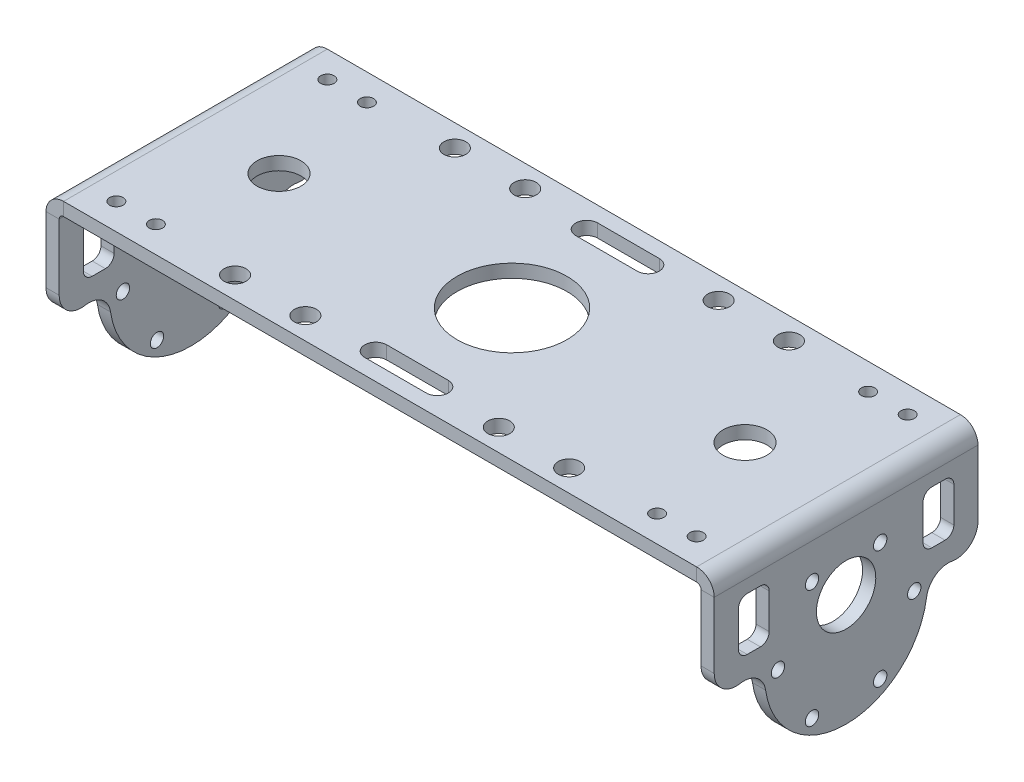
from build123d import *

# Parameters (mm, degrees)
SKETCH_1_W             = 144
SKETCH_1_H             = 60
SM_BASE_FLANGE_1_DEPTH = 3
SM_EDGE_FLANGE_1_DEPTH = 60
SM_EDGE_FLANGE_2_DEPTH = 60
CUT_EXTRUDE_1_REACH    = 162.265
SKETCH_16_R            = 1.525
SKETCH_16_R_2          = 6.75
CUT_EXTRUDE_2_REACH    = 94.801
SKETCH_19_W            = 14
SKETCH_19_H            = 5
CUT_EXTRUDE_3_REACH    = 94.801
SKETCH_22_R            = 1.525
CUT_EXTRUDE_4_REACH    = 94.801
SKETCH_25_R            = 2.5
CUT_EXTRUDE_5_REACH    = 94.801
SKETCH_28_R            = 12.5
SKETCH_28_R_2          = 5
SKETCH_29_W            = 7
SKETCH_29_H            = 12
CUT_EXTRUDE_6_DEPTH    = 161.265404876
FILLET_1_R             = 2
FILLET_2_R             = 2


# Sheet-metal steps are written as plain solids
with BuildPart() as part:
    # Sketch 1 → 基体-法兰1 (new body)
    with BuildSketch(Plane(origin=(0, 0, 0), x_dir=(1, 0, 0), z_dir=(0, 1, 0))):
        Rectangle(SKETCH_1_W, SKETCH_1_H)
    extrude(amount=SM_BASE_FLANGE_1_DEPTH)

    # 边线-法兰1 section (across the edge) → 边线-法兰1 (add)
    with BuildSketch(Plane(origin=(73, 0, -30), x_dir=(-1, 0, 0), z_dir=(0, 0, 1))):
        with BuildLine():
            Line((-3, 1), (-3, 41))
            Line((-3, 41), (0, 41))
            Line((0, 41), (0, 1))
            ThreePointArc((0, 1), (0.292893219, 0.292893219), (1, 0))
            Line((1, 0), (1, -3))
            ThreePointArc((1, -3), (-1.828427125, -1.828427125), (-3, 1))
        make_face()
    extrude(amount=SM_EDGE_FLANGE_1_DEPTH)

    # 边线-法兰2 section (across the edge) → 边线-法兰2 (add)
    with BuildSketch(Plane(origin=(-73, 0, 30), x_dir=(1, 0, 0), z_dir=(0, 0, -1))):
        with BuildLine():
            Line((-3, 1), (-3, 41))
            Line((-3, 41), (0, 41))
            Line((0, 41), (0, 1))
            ThreePointArc((0, 1), (0.292893219, 0.292893219), (1, 0))
            Line((1, 0), (1, -3))
            ThreePointArc((1, -3), (-1.828427125, -1.828427125), (-3, 1))
        make_face()
    extrude(amount=SM_EDGE_FLANGE_2_DEPTH)

    # 切除-拉伸1: up to this face of the body (flat: up to its plane)
    cut_extrude_1_end = Plane(part.part.faces().sort_by_distance((76, -21, 0))[0])
    # 草图16 → 切除-拉伸1 (cut, up to the picked face)
    with BuildSketch(Plane.ZY.offset(76), mode=Mode.PRIVATE) as cut_extrude_1_sk1:
        with Locations(Location((15.5, -22.5, 0), (0, 0, 90))):
            Circle(SKETCH_16_R)
    cut_extrude_1_tool1 = split(extrude(cut_extrude_1_sk1.sketch, amount=-CUT_EXTRUDE_1_REACH, mode=Mode.PRIVATE), bisect_by=cut_extrude_1_end, keep=Keep.BOTH, mode=Mode.PRIVATE)
    # 草图16 → 切除-拉伸1 (cut, up to the picked face)
    with BuildSketch(Plane.ZY.offset(76), mode=Mode.PRIVATE) as cut_extrude_1_sk2:
        with Locations(Location((7.75, -35.923393759, 0), (0, 0, 90))):
            Circle(SKETCH_16_R)
    cut_extrude_1_tool2 = split(extrude(cut_extrude_1_sk2.sketch, amount=-CUT_EXTRUDE_1_REACH, mode=Mode.PRIVATE), bisect_by=cut_extrude_1_end, keep=Keep.BOTH, mode=Mode.PRIVATE)
    # 草图16 → 切除-拉伸1 (cut, up to the picked face)
    with BuildSketch(Plane.ZY.offset(76), mode=Mode.PRIVATE) as cut_extrude_1_sk3:
        with BuildLine():
            ThreePointArc((24.130177502, -20.923759623), (20.328772761, -21.797108704), (18.311343301, -25.135281108))
            ThreePointArc((18.311343301, -25.135281108), (12.113985709, -36.482179739), (0, -41))
            Line((0, -41), (30, -41))
            Line((30, -41), (30, -16))
            ThreePointArc((30, -16), (28.213322853, -19.830738342), (24.130177502, -20.923759623))
        make_face()
    cut_extrude_1_tool3 = split(extrude(cut_extrude_1_sk3.sketch, amount=-CUT_EXTRUDE_1_REACH, mode=Mode.PRIVATE), bisect_by=cut_extrude_1_end, keep=Keep.BOTH, mode=Mode.PRIVATE)
    # 草图16 → 切除-拉伸1 (cut, up to the picked face)
    with BuildSketch(Plane.ZY.offset(76), mode=Mode.PRIVATE) as cut_extrude_1_sk4:
        with Locations(Location((-15.5, -22.5, 0), (0, 0, 90))):
            Circle(SKETCH_16_R)
    cut_extrude_1_tool4 = split(extrude(cut_extrude_1_sk4.sketch, amount=-CUT_EXTRUDE_1_REACH, mode=Mode.PRIVATE), bisect_by=cut_extrude_1_end, keep=Keep.BOTH, mode=Mode.PRIVATE)
    # 草图16 → 切除-拉伸1 (cut, up to the picked face)
    with BuildSketch(Plane.ZY.offset(76), mode=Mode.PRIVATE) as cut_extrude_1_sk5:
        with Locations(Location((0, -15.5, 0), (0, 0, 90))):
            Circle(SKETCH_16_R_2)
    cut_extrude_1_tool5 = split(extrude(cut_extrude_1_sk5.sketch, amount=-CUT_EXTRUDE_1_REACH, mode=Mode.PRIVATE), bisect_by=cut_extrude_1_end, keep=Keep.BOTH, mode=Mode.PRIVATE)
    # 草图16 → 切除-拉伸1 (cut, up to the picked face)
    with BuildSketch(Plane.ZY.offset(76), mode=Mode.PRIVATE) as cut_extrude_1_sk6:
        with Locations(Location((7.75, -9.076606241, 0), (0, 0, 90))):
            Circle(SKETCH_16_R)
    cut_extrude_1_tool6 = split(extrude(cut_extrude_1_sk6.sketch, amount=-CUT_EXTRUDE_1_REACH, mode=Mode.PRIVATE), bisect_by=cut_extrude_1_end, keep=Keep.BOTH, mode=Mode.PRIVATE)
    # 草图16 → 切除-拉伸1 (cut, up to the picked face)
    with BuildSketch(Plane.ZY.offset(76), mode=Mode.PRIVATE) as cut_extrude_1_sk7:
        with BuildLine():
            Line((-30, -41), (0, -41))
            ThreePointArc((0, -41), (-12.113985709, -36.482179739), (-18.311343301, -25.135281108))
            ThreePointArc((-18.311343301, -25.135281108), (-20.328772761, -21.797108704), (-24.130177502, -20.923759623))
            ThreePointArc((-24.130177502, -20.923759623), (-28.213322853, -19.830738342), (-30, -16))
            Line((-30, -16), (-30, -41))
        make_face()
    cut_extrude_1_tool7 = split(extrude(cut_extrude_1_sk7.sketch, amount=-CUT_EXTRUDE_1_REACH, mode=Mode.PRIVATE), bisect_by=cut_extrude_1_end, keep=Keep.BOTH, mode=Mode.PRIVATE)
    # 草图16 → 切除-拉伸1 (cut, up to the picked face)
    with BuildSketch(Plane.ZY.offset(76), mode=Mode.PRIVATE) as cut_extrude_1_sk8:
        with Locations(Location((-7.75, -35.923393759, 0), (0, 0, 90))):
            Circle(SKETCH_16_R)
    cut_extrude_1_tool8 = split(extrude(cut_extrude_1_sk8.sketch, amount=-CUT_EXTRUDE_1_REACH, mode=Mode.PRIVATE), bisect_by=cut_extrude_1_end, keep=Keep.BOTH, mode=Mode.PRIVATE)
    # 草图16 → 切除-拉伸1 (cut, up to the picked face)
    with BuildSketch(Plane.ZY.offset(76), mode=Mode.PRIVATE) as cut_extrude_1_sk9:
        with Locations(Location((-7.75, -9.076606241, 0), (0, 0, 90))):
            Circle(SKETCH_16_R)
    cut_extrude_1_tool9 = split(extrude(cut_extrude_1_sk9.sketch, amount=-CUT_EXTRUDE_1_REACH, mode=Mode.PRIVATE), bisect_by=cut_extrude_1_end, keep=Keep.BOTH, mode=Mode.PRIVATE)
    add(cut_extrude_1_tool1.solids().sort_by(Axis((-76, -22.5, 15.5), (1, 0, 0)))[0], mode=Mode.SUBTRACT)
    add(cut_extrude_1_tool2.solids().sort_by(Axis((-76, -35.923394, 7.75), (1, 0, 0)))[0], mode=Mode.SUBTRACT)
    add(cut_extrude_1_tool3.solids().sort_by(Axis((-76, -32.323593, 22.013669), (1, 0, 0)))[0], mode=Mode.SUBTRACT)
    add(cut_extrude_1_tool4.solids().sort_by(Axis((-76, -22.5, -15.5), (1, 0, 0)))[0], mode=Mode.SUBTRACT)
    add(cut_extrude_1_tool5.solids().sort_by(Axis((-76, -15.5, 0), (1, 0, 0)))[0], mode=Mode.SUBTRACT)
    add(cut_extrude_1_tool6.solids().sort_by(Axis((-76, -9.076606, 7.75), (1, 0, 0)))[0], mode=Mode.SUBTRACT)
    add(cut_extrude_1_tool7.solids().sort_by(Axis((-76, -32.323593, -22.013669), (1, 0, 0)))[0], mode=Mode.SUBTRACT)
    add(cut_extrude_1_tool8.solids().sort_by(Axis((-76, -35.923394, -7.75), (1, 0, 0)))[0], mode=Mode.SUBTRACT)
    add(cut_extrude_1_tool9.solids().sort_by(Axis((-76, -9.076606, -7.75), (1, 0, 0)))[0], mode=Mode.SUBTRACT)

    # 草图19 → 切除-拉伸2 (cut, up to next)
    with BuildSketch(Plane(origin=(0, 3, 0), x_dir=(1, 0, 0), z_dir=(0, 1, 0)), mode=Mode.PRIVATE) as cut_extrude_2_sk1:
        with BuildLine():
            ThreePointArc((-7, -26.5), (-9.5, -24), (-7, -21.5))
            Line((-7, -21.5), (-7, -26.5))
        make_face()
    cut_extrude_2_tool1 = extrude(cut_extrude_2_sk1.sketch, amount=-CUT_EXTRUDE_2_REACH, mode=Mode.PRIVATE) & part.part
    # 草图19 → 切除-拉伸2 (cut, up to next)
    with BuildSketch(Plane(origin=(0, 3, 0), x_dir=(1, 0, 0), z_dir=(0, 1, 0)), mode=Mode.PRIVATE) as cut_extrude_2_sk2:
        with Locations((0, -24)):
            Rectangle(SKETCH_19_W, SKETCH_19_H)
    cut_extrude_2_tool2 = extrude(cut_extrude_2_sk2.sketch, amount=-CUT_EXTRUDE_2_REACH, mode=Mode.PRIVATE) & part.part
    # 草图19 → 切除-拉伸2 (cut, up to next)
    with BuildSketch(Plane(origin=(0, 3, 0), x_dir=(1, 0, 0), z_dir=(0, 1, 0)), mode=Mode.PRIVATE) as cut_extrude_2_sk3:
        with BuildLine():
            ThreePointArc((7, -21.5), (9.5, -24), (7, -26.5))
            Line((7, -26.5), (7, -21.5))
        make_face()
    cut_extrude_2_tool3 = extrude(cut_extrude_2_sk3.sketch, amount=-CUT_EXTRUDE_2_REACH, mode=Mode.PRIVATE) & part.part
    # 草图19 → 切除-拉伸2 (cut, up to next)
    with BuildSketch(Plane(origin=(0, 3, 0), x_dir=(1, 0, 0), z_dir=(0, 1, 0)), mode=Mode.PRIVATE) as cut_extrude_2_sk4:
        with BuildLine():
            Line((-7, 21.5), (-7, 26.5))
            ThreePointArc((-7, 26.5), (-9.5, 24), (-7, 21.5))
        make_face()
    cut_extrude_2_tool4 = extrude(cut_extrude_2_sk4.sketch, amount=-CUT_EXTRUDE_2_REACH, mode=Mode.PRIVATE) & part.part
    # 草图19 → 切除-拉伸2 (cut, up to next)
    with BuildSketch(Plane(origin=(0, 3, 0), x_dir=(1, 0, 0), z_dir=(0, 1, 0)), mode=Mode.PRIVATE) as cut_extrude_2_sk5:
        with Locations((0, 24)):
            Rectangle(SKETCH_19_W, SKETCH_19_H)
    cut_extrude_2_tool5 = extrude(cut_extrude_2_sk5.sketch, amount=-CUT_EXTRUDE_2_REACH, mode=Mode.PRIVATE) & part.part
    # 草图19 → 切除-拉伸2 (cut, up to next)
    with BuildSketch(Plane(origin=(0, 3, 0), x_dir=(1, 0, 0), z_dir=(0, 1, 0)), mode=Mode.PRIVATE) as cut_extrude_2_sk6:
        with BuildLine():
            Line((7, 21.5), (7, 26.5))
            ThreePointArc((7, 26.5), (9.5, 24), (7, 21.5))
        make_face()
    cut_extrude_2_tool6 = extrude(cut_extrude_2_sk6.sketch, amount=-CUT_EXTRUDE_2_REACH, mode=Mode.PRIVATE) & part.part
    add(cut_extrude_2_tool1.solids().sort_by_distance((-8.061033, 3, 24))[0], mode=Mode.SUBTRACT)
    add(cut_extrude_2_tool2.solids().sort_by_distance((0, 3, 24))[0], mode=Mode.SUBTRACT)
    add(cut_extrude_2_tool3.solids().sort_by_distance((8.061033, 3, 24))[0], mode=Mode.SUBTRACT)
    add(cut_extrude_2_tool4.solids().sort_by_distance((-8.061033, 3, -24))[0], mode=Mode.SUBTRACT)
    add(cut_extrude_2_tool5.solids().sort_by_distance((0, 3, -24))[0], mode=Mode.SUBTRACT)
    add(cut_extrude_2_tool6.solids().sort_by_distance((8.061033, 3, -24))[0], mode=Mode.SUBTRACT)

    # 草图22 → 切除-拉伸3 (cut, up to next)
    with BuildSketch(Plane(origin=(0, 3, 0), x_dir=(1, 0, 0), z_dir=(0, 1, 0)), mode=Mode.PRIVATE) as cut_extrude_3_sk1:
        with Locations(Location((-66, 24, 0), (0, 0, 270))):
            Circle(SKETCH_22_R)
    cut_extrude_3_tool1 = extrude(cut_extrude_3_sk1.sketch, amount=-CUT_EXTRUDE_3_REACH, mode=Mode.PRIVATE) & part.part
    # 草图22 → 切除-拉伸3 (cut, up to next)
    with BuildSketch(Plane(origin=(0, 3, 0), x_dir=(1, 0, 0), z_dir=(0, 1, 0)), mode=Mode.PRIVATE) as cut_extrude_3_sk2:
        with Locations(Location((-66, -24, 0), (0, 0, 270))):
            Circle(SKETCH_22_R)
    cut_extrude_3_tool2 = extrude(cut_extrude_3_sk2.sketch, amount=-CUT_EXTRUDE_3_REACH, mode=Mode.PRIVATE) & part.part
    # 草图22 → 切除-拉伸3 (cut, up to next)
    with BuildSketch(Plane(origin=(0, 3, 0), x_dir=(1, 0, 0), z_dir=(0, 1, 0)), mode=Mode.PRIVATE) as cut_extrude_3_sk3:
        with Locations(Location((66, 24, 0), (0, 0, 270))):
            Circle(SKETCH_22_R)
    cut_extrude_3_tool3 = extrude(cut_extrude_3_sk3.sketch, amount=-CUT_EXTRUDE_3_REACH, mode=Mode.PRIVATE) & part.part
    # 草图22 → 切除-拉伸3 (cut, up to next)
    with BuildSketch(Plane(origin=(0, 3, 0), x_dir=(1, 0, 0), z_dir=(0, 1, 0)), mode=Mode.PRIVATE) as cut_extrude_3_sk4:
        with Locations(Location((66, -24, 0), (0, 0, 270))):
            Circle(SKETCH_22_R)
    cut_extrude_3_tool4 = extrude(cut_extrude_3_sk4.sketch, amount=-CUT_EXTRUDE_3_REACH, mode=Mode.PRIVATE) & part.part
    # 草图22 → 切除-拉伸3 (cut, up to next)
    with BuildSketch(Plane(origin=(0, 3, 0), x_dir=(1, 0, 0), z_dir=(0, 1, 0)), mode=Mode.PRIVATE) as cut_extrude_3_sk5:
        with Locations(Location((-57, 24, 0), (0, 0, 270))):
            Circle(SKETCH_22_R)
    cut_extrude_3_tool5 = extrude(cut_extrude_3_sk5.sketch, amount=-CUT_EXTRUDE_3_REACH, mode=Mode.PRIVATE) & part.part
    # 草图22 → 切除-拉伸3 (cut, up to next)
    with BuildSketch(Plane(origin=(0, 3, 0), x_dir=(1, 0, 0), z_dir=(0, 1, 0)), mode=Mode.PRIVATE) as cut_extrude_3_sk6:
        with Locations(Location((-57, -24, 0), (0, 0, 270))):
            Circle(SKETCH_22_R)
    cut_extrude_3_tool6 = extrude(cut_extrude_3_sk6.sketch, amount=-CUT_EXTRUDE_3_REACH, mode=Mode.PRIVATE) & part.part
    # 草图22 → 切除-拉伸3 (cut, up to next)
    with BuildSketch(Plane(origin=(0, 3, 0), x_dir=(1, 0, 0), z_dir=(0, 1, 0)), mode=Mode.PRIVATE) as cut_extrude_3_sk7:
        with Locations(Location((57, 24, 0), (0, 0, 270))):
            Circle(SKETCH_22_R)
    cut_extrude_3_tool7 = extrude(cut_extrude_3_sk7.sketch, amount=-CUT_EXTRUDE_3_REACH, mode=Mode.PRIVATE) & part.part
    # 草图22 → 切除-拉伸3 (cut, up to next)
    with BuildSketch(Plane(origin=(0, 3, 0), x_dir=(1, 0, 0), z_dir=(0, 1, 0)), mode=Mode.PRIVATE) as cut_extrude_3_sk8:
        with Locations(Location((57, -24, 0), (0, 0, 270))):
            Circle(SKETCH_22_R)
    cut_extrude_3_tool8 = extrude(cut_extrude_3_sk8.sketch, amount=-CUT_EXTRUDE_3_REACH, mode=Mode.PRIVATE) & part.part
    add(cut_extrude_3_tool1.solids().sort_by_distance((-66, 3, -24))[0], mode=Mode.SUBTRACT)
    add(cut_extrude_3_tool2.solids().sort_by_distance((-66, 3, 24))[0], mode=Mode.SUBTRACT)
    add(cut_extrude_3_tool3.solids().sort_by_distance((66, 3, -24))[0], mode=Mode.SUBTRACT)
    add(cut_extrude_3_tool4.solids().sort_by_distance((66, 3, 24))[0], mode=Mode.SUBTRACT)
    add(cut_extrude_3_tool5.solids().sort_by_distance((-57, 3, -24))[0], mode=Mode.SUBTRACT)
    add(cut_extrude_3_tool6.solids().sort_by_distance((-57, 3, 24))[0], mode=Mode.SUBTRACT)
    add(cut_extrude_3_tool7.solids().sort_by_distance((57, 3, -24))[0], mode=Mode.SUBTRACT)
    add(cut_extrude_3_tool8.solids().sort_by_distance((57, 3, 24))[0], mode=Mode.SUBTRACT)

    # 草图25 → 切除-拉伸4 (cut, up to next)
    with BuildSketch(Plane(origin=(0, 3, 0), x_dir=(1, 0, 0), z_dir=(0, 1, 0)), mode=Mode.PRIVATE) as cut_extrude_4_sk1:
        with Locations(Location((-38, 25, 0), (0, 0, 270))):
            Circle(SKETCH_25_R)
    cut_extrude_4_tool1 = extrude(cut_extrude_4_sk1.sketch, amount=-CUT_EXTRUDE_4_REACH, mode=Mode.PRIVATE) & part.part
    # 草图25 → 切除-拉伸4 (cut, up to next)
    with BuildSketch(Plane(origin=(0, 3, 0), x_dir=(1, 0, 0), z_dir=(0, 1, 0)), mode=Mode.PRIVATE) as cut_extrude_4_sk2:
        with Locations(Location((-22, 25, 0), (0, 0, 270))):
            Circle(SKETCH_25_R)
    cut_extrude_4_tool2 = extrude(cut_extrude_4_sk2.sketch, amount=-CUT_EXTRUDE_4_REACH, mode=Mode.PRIVATE) & part.part
    # 草图25 → 切除-拉伸4 (cut, up to next)
    with BuildSketch(Plane(origin=(0, 3, 0), x_dir=(1, 0, 0), z_dir=(0, 1, 0)), mode=Mode.PRIVATE) as cut_extrude_4_sk3:
        with Locations(Location((22, 25, 0), (0, 0, 270))):
            Circle(SKETCH_25_R)
    cut_extrude_4_tool3 = extrude(cut_extrude_4_sk3.sketch, amount=-CUT_EXTRUDE_4_REACH, mode=Mode.PRIVATE) & part.part
    # 草图25 → 切除-拉伸4 (cut, up to next)
    with BuildSketch(Plane(origin=(0, 3, 0), x_dir=(1, 0, 0), z_dir=(0, 1, 0)), mode=Mode.PRIVATE) as cut_extrude_4_sk4:
        with Locations(Location((38, 25, 0), (0, 0, 270))):
            Circle(SKETCH_25_R)
    cut_extrude_4_tool4 = extrude(cut_extrude_4_sk4.sketch, amount=-CUT_EXTRUDE_4_REACH, mode=Mode.PRIVATE) & part.part
    # 草图25 → 切除-拉伸4 (cut, up to next)
    with BuildSketch(Plane(origin=(0, 3, 0), x_dir=(1, 0, 0), z_dir=(0, 1, 0)), mode=Mode.PRIVATE) as cut_extrude_4_sk5:
        with Locations(Location((38, -25, 0), (0, 0, 270))):
            Circle(SKETCH_25_R)
    cut_extrude_4_tool5 = extrude(cut_extrude_4_sk5.sketch, amount=-CUT_EXTRUDE_4_REACH, mode=Mode.PRIVATE) & part.part
    # 草图25 → 切除-拉伸4 (cut, up to next)
    with BuildSketch(Plane(origin=(0, 3, 0), x_dir=(1, 0, 0), z_dir=(0, 1, 0)), mode=Mode.PRIVATE) as cut_extrude_4_sk6:
        with Locations(Location((22, -25, 0), (0, 0, 270))):
            Circle(SKETCH_25_R)
    cut_extrude_4_tool6 = extrude(cut_extrude_4_sk6.sketch, amount=-CUT_EXTRUDE_4_REACH, mode=Mode.PRIVATE) & part.part
    # 草图25 → 切除-拉伸4 (cut, up to next)
    with BuildSketch(Plane(origin=(0, 3, 0), x_dir=(1, 0, 0), z_dir=(0, 1, 0)), mode=Mode.PRIVATE) as cut_extrude_4_sk7:
        with Locations(Location((-22, -25, 0), (0, 0, 270))):
            Circle(SKETCH_25_R)
    cut_extrude_4_tool7 = extrude(cut_extrude_4_sk7.sketch, amount=-CUT_EXTRUDE_4_REACH, mode=Mode.PRIVATE) & part.part
    # 草图25 → 切除-拉伸4 (cut, up to next)
    with BuildSketch(Plane(origin=(0, 3, 0), x_dir=(1, 0, 0), z_dir=(0, 1, 0)), mode=Mode.PRIVATE) as cut_extrude_4_sk8:
        with Locations(Location((-38, -25, 0), (0, 0, 270))):
            Circle(SKETCH_25_R)
    cut_extrude_4_tool8 = extrude(cut_extrude_4_sk8.sketch, amount=-CUT_EXTRUDE_4_REACH, mode=Mode.PRIVATE) & part.part
    add(cut_extrude_4_tool1.solids().sort_by_distance((-38, 3, -25))[0], mode=Mode.SUBTRACT)
    add(cut_extrude_4_tool2.solids().sort_by_distance((-22, 3, -25))[0], mode=Mode.SUBTRACT)
    add(cut_extrude_4_tool3.solids().sort_by_distance((22, 3, -25))[0], mode=Mode.SUBTRACT)
    add(cut_extrude_4_tool4.solids().sort_by_distance((38, 3, -25))[0], mode=Mode.SUBTRACT)
    add(cut_extrude_4_tool5.solids().sort_by_distance((38, 3, 25))[0], mode=Mode.SUBTRACT)
    add(cut_extrude_4_tool6.solids().sort_by_distance((22, 3, 25))[0], mode=Mode.SUBTRACT)
    add(cut_extrude_4_tool7.solids().sort_by_distance((-22, 3, 25))[0], mode=Mode.SUBTRACT)
    add(cut_extrude_4_tool8.solids().sort_by_distance((-38, 3, 25))[0], mode=Mode.SUBTRACT)

    # 草图28 → 切除-拉伸5 (cut, up to next)
    with BuildSketch(Plane(origin=(0, 3, 0), x_dir=(1, 0, 0), z_dir=(0, 1, 0)), mode=Mode.PRIVATE) as cut_extrude_5_sk1:
        with Locations(Location((0, 0, 0), (0, 0, 270))):
            Circle(SKETCH_28_R)
    cut_extrude_5_tool1 = extrude(cut_extrude_5_sk1.sketch, amount=-CUT_EXTRUDE_5_REACH, mode=Mode.PRIVATE) & part.part
    # 草图28 → 切除-拉伸5 (cut, up to next)
    with BuildSketch(Plane(origin=(0, 3, 0), x_dir=(1, 0, 0), z_dir=(0, 1, 0)), mode=Mode.PRIVATE) as cut_extrude_5_sk2:
        with Locations(Location((-53, 0, 0), (0, 0, 270))):
            Circle(SKETCH_28_R_2)
    cut_extrude_5_tool2 = extrude(cut_extrude_5_sk2.sketch, amount=-CUT_EXTRUDE_5_REACH, mode=Mode.PRIVATE) & part.part
    # 草图28 → 切除-拉伸5 (cut, up to next)
    with BuildSketch(Plane(origin=(0, 3, 0), x_dir=(1, 0, 0), z_dir=(0, 1, 0)), mode=Mode.PRIVATE) as cut_extrude_5_sk3:
        with Locations(Location((53, 0, 0), (0, 0, 270))):
            Circle(SKETCH_28_R_2)
    cut_extrude_5_tool3 = extrude(cut_extrude_5_sk3.sketch, amount=-CUT_EXTRUDE_5_REACH, mode=Mode.PRIVATE) & part.part
    add(cut_extrude_5_tool1.solids().sort_by_distance((0, 3, 0))[0], mode=Mode.SUBTRACT)
    add(cut_extrude_5_tool2.solids().sort_by_distance((-53, 3, 0))[0], mode=Mode.SUBTRACT)
    add(cut_extrude_5_tool3.solids().sort_by_distance((53, 3, 0))[0], mode=Mode.SUBTRACT)

    # 草图29 → 切除-拉伸6 (cut, through all)
    with BuildSketch(Plane.ZY.offset(76)):
        with Locations((-21, -10)):
            Rectangle(SKETCH_29_W, SKETCH_29_H)
        with Locations((21, -10)):
            Rectangle(SKETCH_29_W, SKETCH_29_H)
    extrude(amount=-CUT_EXTRUDE_6_DEPTH, mode=Mode.SUBTRACT)

    # 圆角1
    fillet_1_edges = [part.edges().sort_by_distance(p)[0] for p in [
        (-74.5, -4, -17.5),
        (-74.5, -16, -17.5),
        (-74.5, -16, -24.5),
        (-74.5, -4, -24.5),
        (-74.5, -4, 24.5),
        (-74.5, -16, 24.5),
        (-74.5, -16, 17.5),
        (-74.5, -4, 17.5),
    ]]
    fillet(fillet_1_edges, radius=FILLET_1_R)

    # 圆角2
    fillet_2_edges = [part.edges().sort_by_distance(p)[0] for p in [
        (74.5, -4, -17.5),
        (74.5, -16, -17.5),
        (74.5, -16, -24.5),
        (74.5, -4, -24.5),
        (74.5, -4, 24.5),
        (74.5, -16, 24.5),
        (74.5, -16, 17.5),
        (74.5, -4, 17.5),
    ]]
    fillet(fillet_2_edges, radius=FILLET_2_R)


solid = part.part
